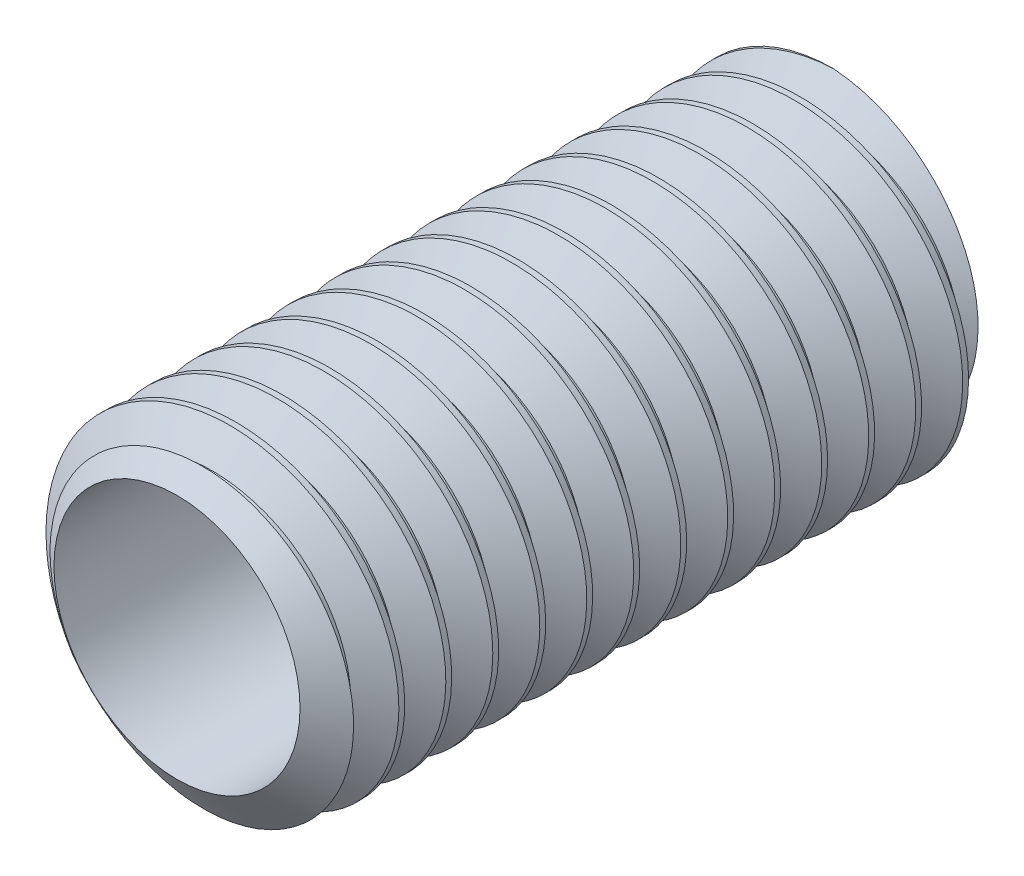
from build123d import *

# Parameters (mm, degrees)
SKETCH1_R                       = 3.175
EXTRUDE1_DEPTH                  = 12.7
CUT_SWEEP1_1_4_28_THREADS_PITCH = 0.907142857
SKETCH11_R                      = 2.375
CUT_EXTRUDE3_DEPTH              = 14.470384323


with BuildPart() as part:
    # Sketch1 → Extrude1 (new body)
    with BuildSketch(Plane.XY):
        Circle(SKETCH1_R)
    extrude(amount=-EXTRUDE1_DEPTH)

    # Cut-Sweep1 1/4-28 threads: the profile of Sketch3 profile screwed along a right-hand helix of 15 turns, 6 arcs to a turn; built about Z, then put on its axis
    cut_sweep1_1_4_28_threads_z = Axis((0, 0, 0), (0, 0, 1))
    cut_sweep1_1_4_28_threads_corners = [(3.1753, 0, -0.793923205), (2.585793431, 0, -0.453571429), (2.585793431, 0, -0.340178571), (3.1753, 0, 0.000173205)]
    with BuildLine(mode=Mode.PRIVATE) as cut_sweep1_1_4_28_threads_profile:
        Line(cut_sweep1_1_4_28_threads_corners[0], cut_sweep1_1_4_28_threads_corners[1])
        Line(cut_sweep1_1_4_28_threads_corners[1], cut_sweep1_1_4_28_threads_corners[2])
        Line(cut_sweep1_1_4_28_threads_corners[2], cut_sweep1_1_4_28_threads_corners[3])
        Line(cut_sweep1_1_4_28_threads_corners[3], cut_sweep1_1_4_28_threads_corners[0])
    cut_sweep1_1_4_28_threads_cap = Face(cut_sweep1_1_4_28_threads_profile.wire())
    cut_sweep1_1_4_28_threads_turn_angles = [0, 30, 60, 90, 120, 150, 180, 210, 240, 270, 300, 330, 360]
    cut_sweep1_1_4_28_threads_turn_weights = [1, 0.8660254037844387, 1, 0.8660254037844387, 1, 0.8660254037844387, 1, 0.8660254037844387, 1, 0.8660254037844387, 1, 0.8660254037844387, 1]
    cut_sweep1_1_4_28_threads_turn_rails = [Edge.make_bspline([Vector(p[0], p[1], 0).rotate(cut_sweep1_1_4_28_threads_z, cut_sweep1_1_4_28_threads_turn_angles[k]) / cut_sweep1_1_4_28_threads_turn_weights[k] + Vector(0, 0, p[2] + CUT_SWEEP1_1_4_28_THREADS_PITCH * cut_sweep1_1_4_28_threads_turn_angles[k] / 360) for k in range(13)], [0, 0, 0, 1, 1, 2, 2, 3, 3, 4, 4, 5, 5, 6, 6, 6], 2, cut_sweep1_1_4_28_threads_turn_weights) for p in cut_sweep1_1_4_28_threads_corners]
    cut_sweep1_1_4_28_threads_turn_sides = [Face.make_surface_from_curves(cut_sweep1_1_4_28_threads_turn_rails[p[0]], cut_sweep1_1_4_28_threads_turn_rails[p[1]]) for p in [(0, 1), (1, 2), (2, 3), (3, 0)]]
    cut_sweep1_1_4_28_threads = Plane(origin=(0, 0, 0), x_dir=(0, 1, 0), z_dir=(0, 0, -1)) * Solid(Shell([*[p.moved(Location((0, 0, CUT_SWEEP1_1_4_28_THREADS_PITCH * i))) for i in range(15) for p in cut_sweep1_1_4_28_threads_turn_sides], cut_sweep1_1_4_28_threads_cap, cut_sweep1_1_4_28_threads_cap.rotate(cut_sweep1_1_4_28_threads_z, 5400).moved(Location((0, 0, CUT_SWEEP1_1_4_28_THREADS_PITCH * 5400 / 360)))]))
    add(cut_sweep1_1_4_28_threads, mode=Mode.SUBTRACT)

    # Sketch4 → Cut-Revolve1 (revolve, cut)
    with BuildSketch(Plane(origin=(0, 0, 0), x_dir=(0, 0, -1), z_dir=(1, 0, 0)), mode=Mode.PRIVATE) as cut_revolve1_sk:
        Polygon((0.590419596, 3.175), (0, 2.331793431), (0, 3.175), align=None)
    revolve(cut_revolve1_sk.sketch.rotate(Axis((0, 0, 0), (0, 0, -1)), 251.116113413), axis=Axis((0, 0, 0), (0, 0, -1)), mode=Mode.SUBTRACT)

    # Sketch11 → Cut-Extrude3 (cut, through all)
    with BuildSketch(Plane(origin=(0, 0, -12.7), x_dir=(-1, 0, 0), z_dir=(0, 0, -1))):
        Circle(SKETCH11_R)
    extrude(amount=-CUT_EXTRUDE3_DEPTH, mode=Mode.SUBTRACT)


solid = part.part
